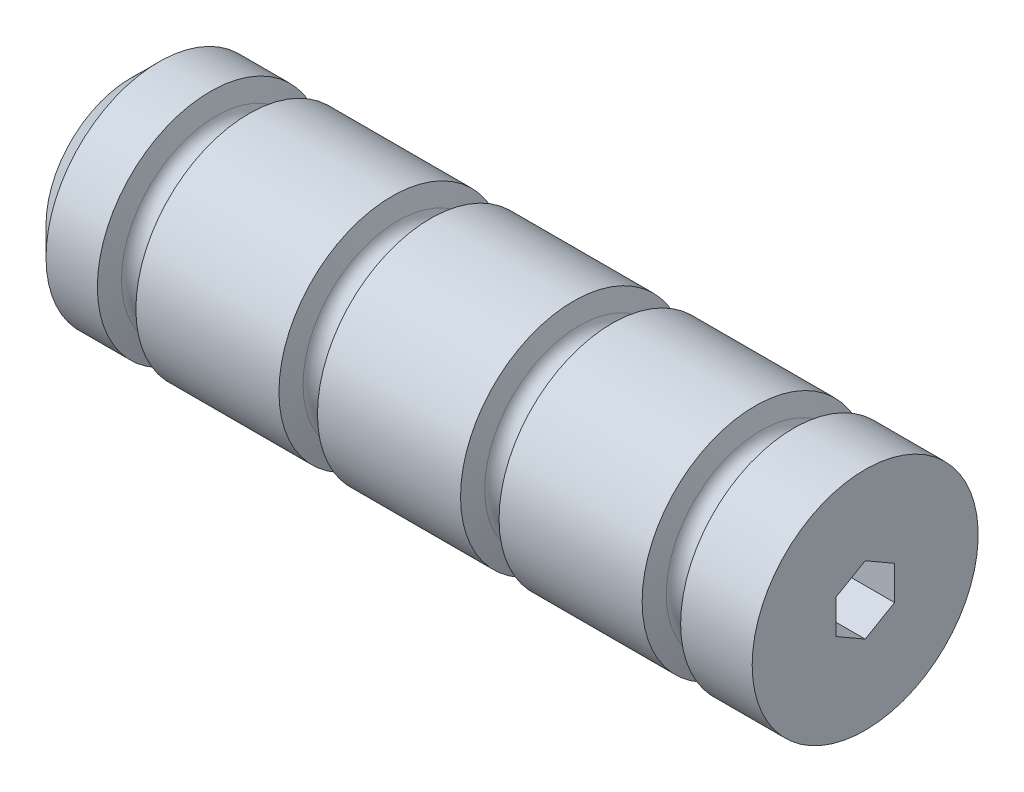
from build123d import *

# Parameters (mm, degrees)
CUT_EXTRUDE1_DEPTH = 169.962510635


with BuildPart() as part:
    # Sketch1 → Revolve1 (revolve)
    with BuildSketch(Plane.XY):
        Polygon((0, 0), (0, 25.4), (-158.75, 25.4), (-165.1, 19.05), (-165.1, 0), align=None)
    revolve(axis=Axis((0, 0, 0), (1, 0, 0)))

    # Sketch2 → Cut-Revolve1 (revolve, cut)
    with BuildSketch(Plane.XY):
        with BuildLine():
            Line((-16.080560659, 25.4), (-17.382662967, 21.270259087))
            ThreePointArc((-17.382662967, 21.270259087), (-20.410714286, 19.05), (-23.438765604, 21.270259087))
            Line((-23.438765604, 21.270259087), (-24.740867913, 25.4))
            Line((-24.740867913, 25.4), (-16.080560659, 25.4))
        make_face()
        with BuildLine():
            Line((-56.90198923, 25.4), (-58.204091539, 21.270259087))
            ThreePointArc((-58.204091539, 21.270259087), (-61.232142857, 19.05), (-64.260194176, 21.270259087))
            Line((-64.260194176, 21.270259087), (-65.562296484, 25.4))
            Line((-65.562296484, 25.4), (-56.90198923, 25.4))
        make_face()
        with BuildLine():
            Line((-97.723417802, 25.4), (-99.02552011, 21.270259087))
            ThreePointArc((-99.02552011, 21.270259087), (-102.053571429, 19.05), (-105.081622747, 21.270259087))
            Line((-105.081622747, 21.270259087), (-106.383725056, 25.4))
            Line((-106.383725056, 25.4), (-97.723417802, 25.4))
        make_face()
        with BuildLine():
            Line((-138.544846373, 25.4), (-139.846948681, 21.270259087))
            ThreePointArc((-139.846948681, 21.270259087), (-142.875, 19.05), (-145.903051319, 21.270259087))
            Line((-145.903051319, 21.270259087), (-147.205153627, 25.4))
            Line((-147.205153627, 25.4), (-138.544846373, 25.4))
        make_face()
    revolve(axis=Axis((0, 0, 0), (1, 0, 0)), mode=Mode.SUBTRACT)

    # Sketch3 → Cut-Extrude1 (cut, through all)
    with BuildSketch(Plane(origin=(0, 0, 0), x_dir=(0, 0, -1), z_dir=(1, 0, 0))):
        Polygon((0, 7.625642355), (-6.604, 3.812821178), (-6.604, -3.812821178), (0, -7.625642355), (6.604, -3.812821178), (6.604, 3.812821178), align=None)
    extrude(amount=-CUT_EXTRUDE1_DEPTH, mode=Mode.SUBTRACT)


solid = part.part
